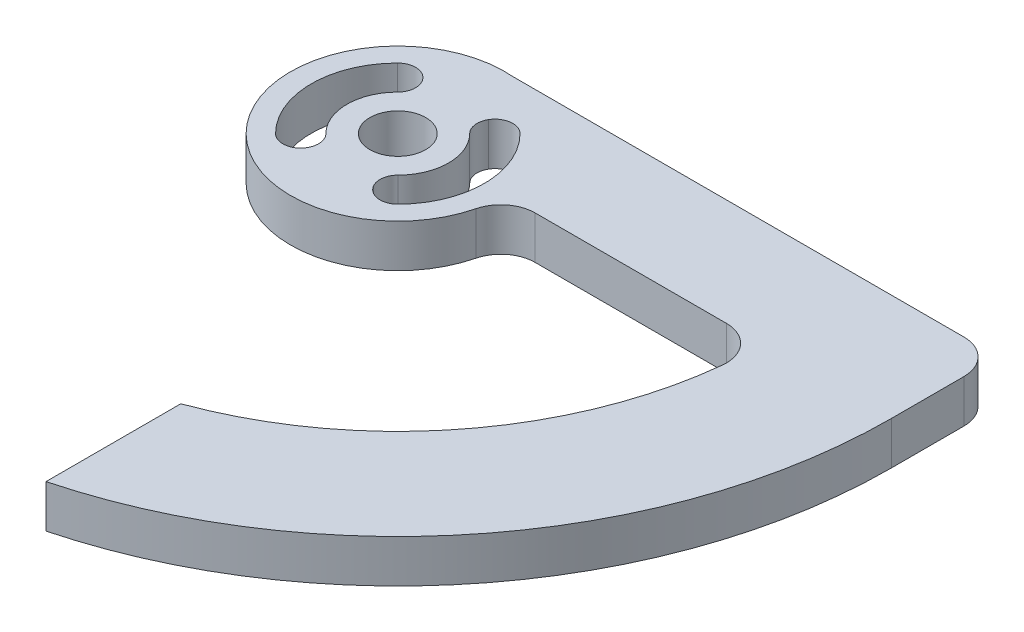
from build123d import *

# Parameters (mm, degrees)
SKETCH1_R               = 12.5
BOSS_EXTRUDE1_DEPTH     = 5
EXTRUDE_THIN1_DEPTH     = 5
SKETCH6_W               = 56.5
SKETCH6_H               = 12.459935794
BOSS_EXTRUDE3_DEPTH     = 5
CUT_EXTRUDE3_DEPTH      = 80.717487022
CUT_EXTRUDE3_DEPTH_BACK = 80.717487022
SKETCH7_R               = 3.25
CUT_EXTRUDE_THIN1_START = -5
CUT_EXTRUDE_THIN1_DEPTH = 85.717487022
FILLET1_R               = 2.075
FILLET2_R               = 4
BOSS_EXTRUDE4_DEPTH     = 5
SKETCH9_4_W             = 9.626496109
SKETCH9_4_H             = 23.122525611
CUT_EXTRUDE5_DEPTH      = 81.602542459


with BuildPart() as part:
    # Sketch1 → Boss-Extrude1 (new body)
    with BuildSketch(Plane(origin=(0, 0, 0), x_dir=(1, 0, 0), z_dir=(0, 1, 0))):
        with Locations(Location((0, 0, 0), (0, 0, 270))):
            Circle(SKETCH1_R)
    extrude(amount=BOSS_EXTRUDE1_DEPTH)



with BuildPart() as body_2:
    # Sketch4 → Extrude-Thin1 (new body)
    with BuildSketch(Plane(origin=(0, 0, 0), x_dir=(1, 0, 0), z_dir=(0, 1, 0))):
        with BuildLine():
            ThreePointArc((16.811373022, -54.987523468), (46.221769485, -34.202310238), (57.5, 0))
            Line((57.5, 0), (42.5, 0))
            ThreePointArc((42.5, 0), (34.163916576, -25.279968437), (12.425797451, -40.642952128))
            Line((12.425797451, -40.642952128), (16.811373022, -54.987523468))
        make_face()
    extrude(amount=EXTRUDE_THIN1_DEPTH)


with BuildPart() as part_1:
    add(part.part)

    add(body_2.part)  # Boss-Extrude3 merges body 2
    # Sketch6 → Boss-Extrude3 (add)
    with BuildSketch(Plane(origin=(0, 0, 0), x_dir=(1, 0, 0), z_dir=(0, 1, 0))):
        with Locations((29.25, 6.229967897)):
            Rectangle(SKETCH6_W, SKETCH6_H)
    extrude(amount=BOSS_EXTRUDE3_DEPTH)

    # Sketch7 → Cut-Extrude3 (cut, two sides: drawn at the far end of the back side and taken through both)
    with BuildSketch(Plane(origin=(0, 5, 0), x_dir=(1, 0, 0), z_dir=(0, 1, 0)).offset(-CUT_EXTRUDE3_DEPTH_BACK)):
        with Locations(Location((0, 0, 0), (0, 0, 270))):
            Circle(SKETCH7_R)
    extrude(amount=CUT_EXTRUDE3_DEPTH + CUT_EXTRUDE3_DEPTH_BACK, mode=Mode.SUBTRACT)

    # Sketch8 → Cut-Extrude-Thin1 (cut)
    with BuildSketch(Plane(origin=(0, 5, 0), x_dir=(1, 0, 0), z_dir=(0, 1, 0)).offset(CUT_EXTRUDE_THIN1_START)):
        with BuildLine():
            ThreePointArc((-5.0375, 8.725205943), (-10.075, 0), (-5.0375, -8.725205943))
            Line((-5.0375, -8.725205943), (-2.9625, -5.131200517))
            ThreePointArc((-2.9625, -5.131200517), (-5.925, 0), (-2.9625, 5.131200517))
            Line((-2.9625, 5.131200517), (-5.0375, 8.725205943))
        make_face()
    cut_extrude_thin1 = extrude(amount=CUT_EXTRUDE_THIN1_DEPTH, mode=Mode.SUBTRACT)

    # Mirror2: Cut-Extrude-Thin1 across plane
    add(cut_extrude_thin1.mirror(Plane(origin=(0, 0, 0), x_dir=(0, 0, 1), z_dir=(1, 0, 0))), mode=Mode.SUBTRACT)

    # Fillet1
    fillet1_edges = [part_1.edges().sort_by_distance(p)[0] for p in [
        (2.9625, 2.5, -5.131200517),
        (5.0375, 2.5, -8.725205943),
        (-5.0375, 2.5, -8.725205943),
        (-2.9625, 2.5, -5.131200517),
        (2.9625, 2.5, 5.131200517),
        (5.0375, 2.5, 8.725205943),
        (-5.0375, 2.5, 8.725205943),
        (-2.9625, 2.5, 5.131200517),
    ]]
    fillet(fillet1_edges, radius=FILLET1_R - 0.0001)  # a hair under: the kernel refuses the full size

    # Fillet2
    fillet2_edges = [part_1.edges().sort_by_distance(p)[0] for p in [
        (42.5, 2.5, 0),
        (12.5, 2.5, 0),
        (57.5, 2.5, -12.459935794),
    ]]
    fillet(fillet2_edges, radius=FILLET2_R)

    # Sketch9 → Boss-Extrude4 (add)
    with BuildSketch(Plane(origin=(0, 0, 0), x_dir=(1, 0, 0), z_dir=(0, 1, 0))):
        with BuildLine():
            Line((16.811373022, -54.987523468), (14.618585236, -47.815237798))
            Line((14.618585236, -47.815237798), (14.618585236, -55.610673128))
            ThreePointArc((14.618585236, -55.610673128), (15.718067562, -55.309966119), (16.811373022, -54.987523468))
        make_face()
        with BuildLine():
            Line((14.618585236, -47.815237798), (12.425797451, -40.642952128))
            Line((12.425797451, -40.642952128), (11.862973877, -56.262952738))
            ThreePointArc((11.862973877, -56.262952738), (13.244795598, -55.953779046), (14.618585236, -55.610673128))
            Line((14.618585236, -55.610673128), (14.618585236, -47.815237798))
        make_face()
    extrude(amount=BOSS_EXTRUDE4_DEPTH)

    # Sketch9<4> → Cut-Extrude5 (cut, through all)
    with BuildSketch(Plane(origin=(0, 0, 0), x_dir=(1, 0, 0), z_dir=(0, 1, 0))):
        with Locations((9.805337182, -49.150976699)):
            Rectangle(SKETCH9_4_W, SKETCH9_4_H)
    extrude(amount=CUT_EXTRUDE5_DEPTH, mode=Mode.SUBTRACT)


solid = part_1.part
